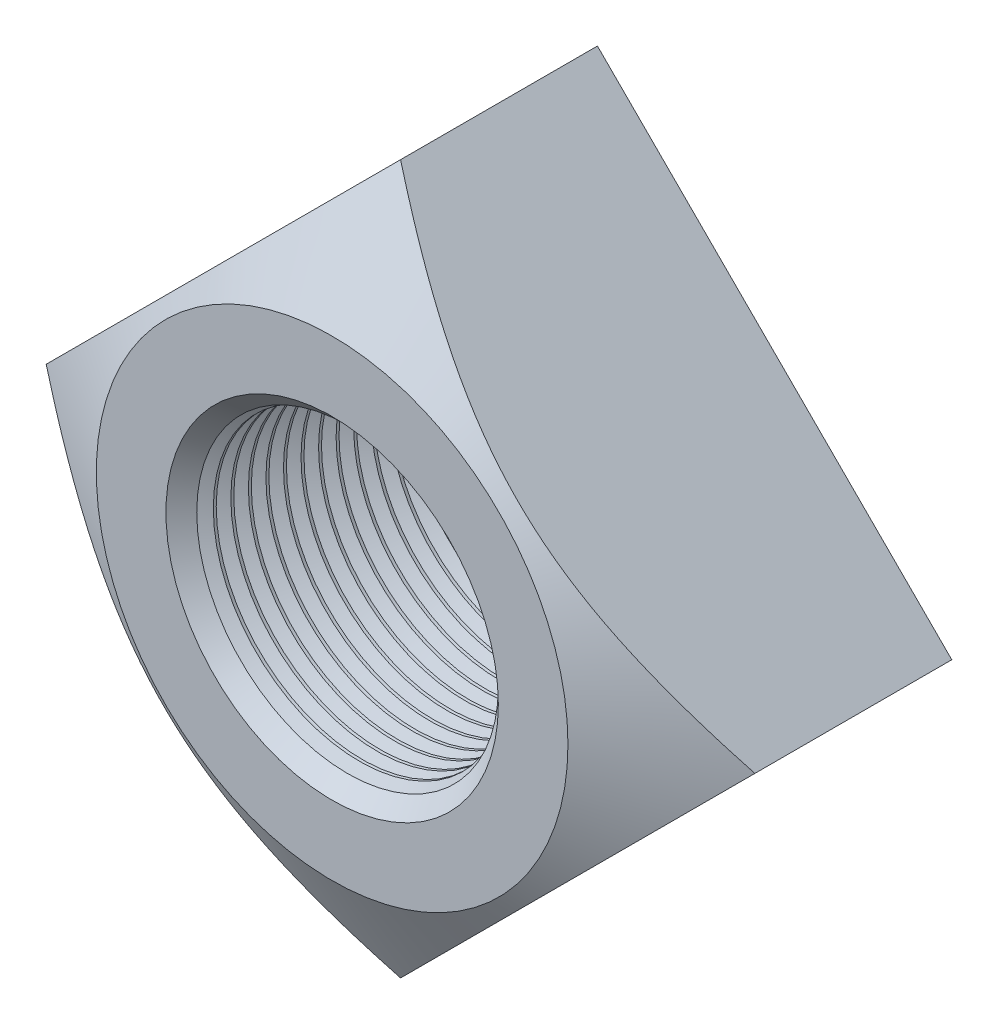
from build123d import *

# Parameters (mm, degrees)
SKETCH1_R        = 9.9175
BASENUT_DEPTH    = 18
CHAMFER1_SIZE    = 1.36
LPATTERN10_COUNT = 13
LPATTERN10_PITCH = 1.1901


with BuildPart() as part:
    # Sketch1 → BaseNut (new body)
    with BuildSketch(Plane.XY):
        Polygon((0, 24.04163056), (-24.04163056, 0), (0, -24.04163056), (24.04163056, 0), align=None)
        Circle(SKETCH1_R, mode=Mode.SUBTRACT)
    extrude(amount=-BASENUT_DEPTH)

    # Sketch2 → Single-Chamfer (revolve, cut)
    with BuildSketch(Plane(origin=(0, 0, 0), x_dir=(-1, 0, 0), z_dir=(0, 1, 0))):
        Polygon((16, 0), (24.04163056, 0), (24.04163056, -4.642837569), align=None)
    revolve(axis=Axis((0, 0, 6.735803747), (0, 0, -1)), mode=Mode.SUBTRACT)

    # Chamfer1
    chamfer1_edges = [part.edges().sort_by_distance(p)[0] for p in [
        (-9.9175, 0, -18),
        (-9.9175, 0, 0),
    ]]
    chamfer(chamfer1_edges, length=CHAMFER1_SIZE)

    # Sketch3 → Cut-Revolve10 (revolve, cut)
    with BuildSketch(Plane(origin=(0, 0, 0), x_dir=(1, 0, 0), z_dir=(0, 1, 0))):
        Polygon((8.92575, 1.855875), (9.9175, 1.855875), (10.776380694, 1.36), (9.9175, 0.864125), (8.92575, 0.864125), align=None)
    cut_revolve10 = revolve(axis=Axis((0, 0, -25.639638929), (0, 0, 1)), mode=Mode.SUBTRACT)

    # LPattern10: Cut-Revolve10 ×13
    with Locations(*[(0, 0, -i * LPATTERN10_PITCH) for i in range(1, LPATTERN10_COUNT)]):
        add(cut_revolve10, mode=Mode.SUBTRACT)


solid = part.part
